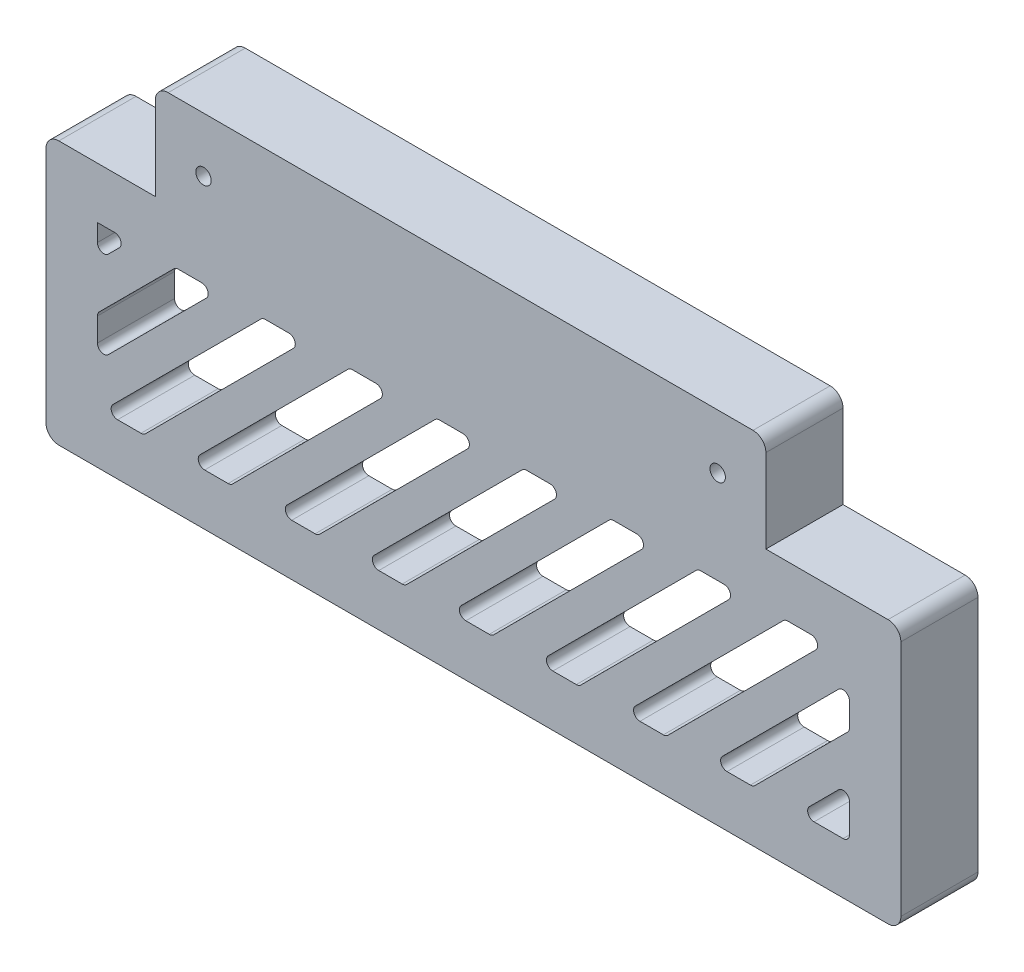
from build123d import *

# Parameters (mm, degrees)
SKETCH1_W            = 133
SKETCH1_H            = 41
BOSS_EXTRUDE1_DEPTH  = 12
SKETCH2_W            = 95
SKETCH2_H            = 12
BOSS_EXTRUDE2_DEPTH  = 15
FILLET1_R            = 2
M2_CLEARANCE_HOLE1_D = 2.4
VENT1_DEPTH          = 12
FILLET2_R            = 1


# Read off the part's stored shape, not the designer's step: Vent1
with BuildPart() as part:
    # Sketch1 → Boss-Extrude1 (new body)
    with BuildSketch(Plane.XY):
        Rectangle(SKETCH1_W, SKETCH1_H)
    extrude(amount=BOSS_EXTRUDE1_DEPTH)

    # Sketch2 → Boss-Extrude2 (add)
    with BuildSketch(Plane(origin=(0, 20.5, 0), x_dir=(1, 0, 0), z_dir=(0, 1, 0))):
        with Locations((-2, -6)):
            Rectangle(SKETCH2_W, SKETCH2_H)
    extrude(amount=BOSS_EXTRUDE2_DEPTH)

    # Fillet1
    fillet1_edges = [part.edges().sort_by_distance(p)[0] for p in [
        (-49.5, 35.5, 6),
        (45.5, 35.5, 6),
        (-66.5, 20.5, 6),
        (66.5, 20.5, 6),
        (66.5, -20.5, 6),
        (-66.5, -20.5, 6),
    ]]
    fillet(fillet1_edges, radius=FILLET1_R)

    # M2 Clearance Hole1 (through all)
    with Locations(Plane(origin=(-42, 27, 12), x_dir=(1, 0, 0), z_dir=(0, 0, 1))):
        with Locations((0, 0), (80, 0)):
            Hole(M2_CLEARANCE_HOLE1_D / 2)

    # Vent1 outline → Vent1 (cut)
    with BuildSketch(Plane.XY):
        Polygon((-39.847390778, 12.5), (-46.320873948, 12.5), (-58.5, 0.320873948), (-58.5, -6.152609222), align=None)
        Polygon((-26.302839797, 12.5), (-32.776322967, 12.5), (-57.776322967, -12.5), (-51.302839797, -12.5), align=None)
        Polygon((-12.758288815, 12.5), (-19.231771985, 12.5), (-44.231771985, -12.5), (-37.758288815, -12.5), align=None)
        Polygon((0.786262167, 12.5), (-5.687221003, 12.5), (-30.687221003, -12.5), (-24.213737833, -12.5), align=None)
        Polygon((14.330813149, 12.5), (7.857329979, 12.5), (-17.142670021, -12.5), (-10.669186851, -12.5), align=None)
        Polygon((27.875364131, 12.5), (21.401880961, 12.5), (-3.598119039, -12.5), (2.875364131, -12.5), align=None)
        Polygon((-53.39194176, 12.5), (-58.5, 12.5), (-58.5, 7.39194176), align=None)
        Polygon((41.419915112, 12.5), (34.946431942, 12.5), (9.946431942, -12.5), (16.419915112, -12.5), align=None)
        Polygon((54.964466094, 12.5), (48.490982924, 12.5), (23.490982924, -12.5), (29.964466094, -12.5), align=None)
        Polygon((37.035533906, -12.5), (43.509017076, -12.5), (58.5, 2.490982924), (58.5, 8.964466094), align=None)
        Polygon((50.580084888, -12.5), (58.5, -12.5), (58.5, -4.580084888), align=None)
    extrude(amount=VENT1_DEPTH, mode=Mode.SUBTRACT)

    # Fillet2
    fillet2_edges = [part.edges().sort_by_distance(p)[0] for p in [
        (50.580084888, -12.5, 6),
        (43.509017076, -12.5, 6),
        (58.5, 2.490982924, 6),
        (58.5, -4.580084888, 6),
        (37.035533906, -12.5, 6),
        (29.964466094, -12.5, 6),
        (54.964466094, 12.5, 6),
        (58.5, 8.964466094, 6),
        (23.490982924, -12.5, 6),
        (16.419915112, -12.5, 6),
        (41.419915112, 12.5, 6),
        (48.490982924, 12.5, 6),
        (9.946431942, -12.5, 6),
        (2.875364131, -12.5, 6),
        (27.875364131, 12.5, 6),
        (34.946431942, 12.5, 6),
        (14.330813149, 12.5, 6),
        (21.401880961, 12.5, 6),
        (-3.598119039, -12.5, 6),
        (-10.669186851, -12.5, 6),
        (0.786262167, 12.5, 6),
        (7.857329979, 12.5, 6),
        (-17.142670021, -12.5, 6),
        (-24.213737833, -12.5, 6),
        (-12.758288815, 12.5, 6),
        (-5.687221003, 12.5, 6),
        (-30.687221003, -12.5, 6),
        (-37.758288815, -12.5, 6),
        (-26.302839797, 12.5, 6),
        (-19.231771985, 12.5, 6),
        (-44.231771985, -12.5, 6),
        (-51.302839797, -12.5, 6),
        (-39.847390778, 12.5, 6),
        (-32.776322967, 12.5, 6),
        (-57.776322967, -12.5, 6),
        (-58.5, -6.152609222, 6),
        (-53.39194176, 12.5, 6),
        (-46.320873948, 12.5, 6),
        (-58.5, 0.320873948, 6),
        (-58.5, 7.39194176, 6),
        (58.5, -12.5, 6),
    ]]
    fillet(fillet2_edges, radius=FILLET2_R)


solid = part.part
